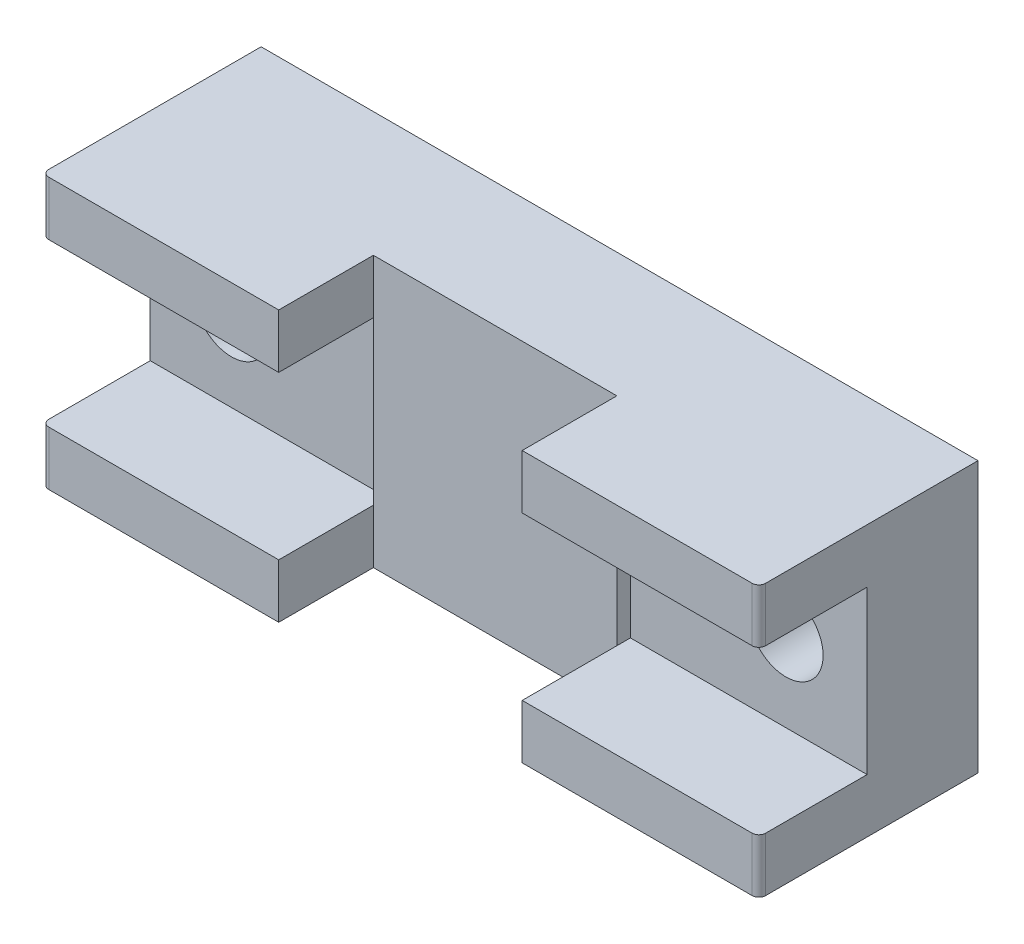
from build123d import *

# Parameters (mm, degrees)
EXTRUDE_1_OUTLINE_W = 53
EXTRUDE_1_OUTLINE_H = 20
EXTRUDE_1_DEPTH     = 8.2
SKETCH_2_W          = 18
SKETCH_2_H          = 20
EXTRUDE_2_DEPTH     = 1
SKETCH_3_R          = 2.75
CUT_EXTRUDE_1_DEPTH = 30.48711583
SKETCH_4_W          = 17.5
SKETCH_4_H          = 4
EXTRUDE_3_DEPTH     = 8
FILLET_1_R          = 0.5


# Read off the part's stored shape, not the designer's step: 보스-돌출1
with BuildPart() as part:
    # 보스-돌출1 outline → 보스-돌출1 (new body)
    with BuildSketch(Plane.XY):
        Rectangle(EXTRUDE_1_OUTLINE_W, EXTRUDE_1_OUTLINE_H)
    extrude(amount=EXTRUDE_1_DEPTH)

    # 스케치2 → 보스-돌출2 (add)
    with BuildSketch(Plane.XY.offset(8.2)):
        Rectangle(SKETCH_2_W, SKETCH_2_H)
    extrude(amount=EXTRUDE_2_DEPTH)

    # 스케치3 → 컷-돌출1 (cut, through all)
    with BuildSketch(Plane.XY.offset(8.2)):
        with Locations((20.5, 0)):
            Circle(SKETCH_3_R)
        with Locations(Location((-20.5, 0, 0), (0, 0, 180))):
            Circle(SKETCH_3_R)
    extrude(amount=-CUT_EXTRUDE_1_DEPTH, mode=Mode.SUBTRACT)

    # 스케치4 → 보스-돌출3 (add)
    with BuildSketch(Plane.XY.offset(8.2)):
        with Locations((17.75, -8)):
            Rectangle(SKETCH_4_W, SKETCH_4_H)
        with Locations((17.75, 8)):
            Rectangle(SKETCH_4_W, SKETCH_4_H)
        with Locations((-17.75, 8)):
            Rectangle(SKETCH_4_W, SKETCH_4_H)
        with Locations((-17.75, -8)):
            Rectangle(SKETCH_4_W, SKETCH_4_H)
    extrude(amount=EXTRUDE_3_DEPTH)

    # 필렛1
    fillet_1_edges = [part.edges().sort_by_distance(p)[0] for p in [
        (26.5, -8, 16.2),
        (26.5, 8, 16.2),
        (-26.5, 8, 16.2),
        (-26.5, -8, 16.2),
    ]]
    fillet(fillet_1_edges, radius=FILLET_1_R)


solid = part.part
